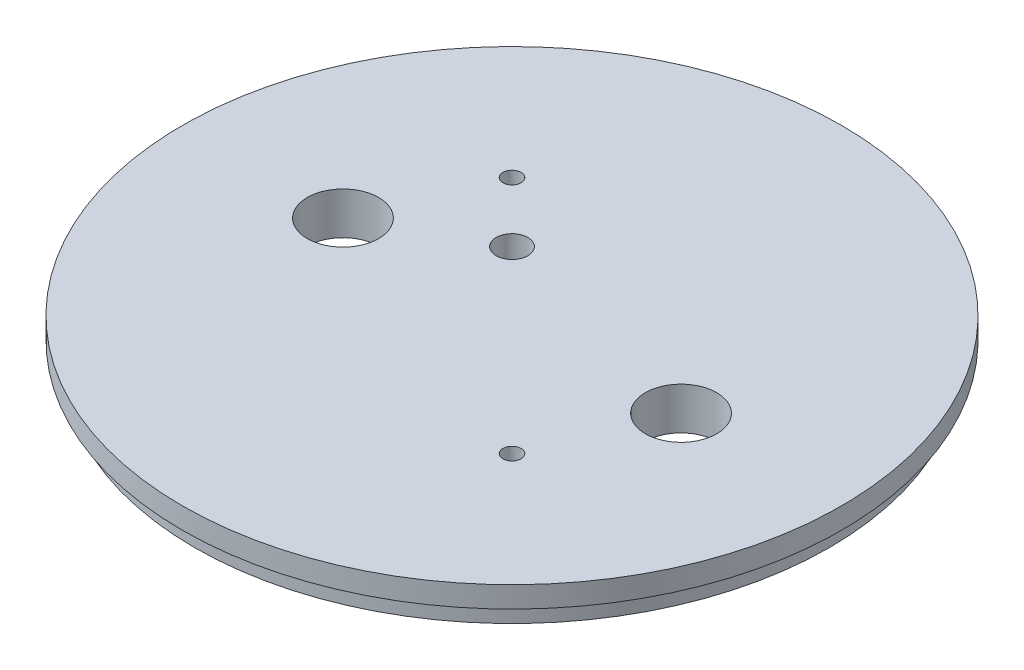
from build123d import *

# Parameters (mm, degrees)
SKETCH1_R           = 49.5173
SKETCH1_R_2         = 5.3578125
SKETCH1_R_3         = 1.3589
SKETCH1_R_4         = 2.38125
BOSS_EXTRUDE1_DEPTH = 6.35
SKETCH2_R           = 49.5173
SKETCH2_R_2         = 47.6885
CUT_EXTRUDE1_DEPTH  = 3.175
CUT_EXTRUDE2_START  = -2.794
CUT_EXTRUDE2_DEPTH  = 3.81


with BuildPart() as part:
    # Sketch1 → Boss-Extrude1 (new body)
    with BuildSketch(Plane(origin=(0, 0, 0), x_dir=(1, 0, 0), z_dir=(0, 1, 0))):
        Circle(SKETCH1_R)
        with Locations((25.4, 0)):
            Circle(SKETCH1_R_2, mode=Mode.SUBTRACT)
        with Locations((-25.4, 0)):
            Circle(SKETCH1_R_2, mode=Mode.SUBTRACT)
        with Locations((-17.960512242, 17.960512242)):
            Circle(SKETCH1_R_3, mode=Mode.SUBTRACT)
        with Locations((17.960512242, -17.960512242)):
            Circle(SKETCH1_R_3, mode=Mode.SUBTRACT)
        with Locations((-8.980256121, 8.980256121)):
            Circle(SKETCH1_R_4, mode=Mode.SUBTRACT)
    extrude(amount=BOSS_EXTRUDE1_DEPTH)

    # Sketch2 → Cut-Extrude1 (cut)
    with BuildSketch(Plane.XZ):
        Circle(SKETCH2_R)
        Circle(SKETCH2_R_2, mode=Mode.SUBTRACT)
    extrude(amount=-CUT_EXTRUDE1_DEPTH, mode=Mode.SUBTRACT)

    # Sketch3 → Cut-Extrude2 (cut)
    with BuildSketch(Plane(origin=(0, 6.35, 0), x_dir=(1, 0, 0), z_dir=(0, 1, 0)).offset(CUT_EXTRUDE2_START)):
        with BuildLine():
            Line((3.2385, 34.798), (3.2385, 13.97))
            ThreePointArc((3.2385, 13.97), (0, 10.7315), (-3.2385, 13.97))
            Line((-3.2385, 13.97), (-3.2385, 34.798))
            ThreePointArc((-3.2385, 34.798), (0, 38.0365), (3.2385, 34.798))
        make_face()
        with BuildLine():
            Line((3.2385, -34.798), (3.2385, -13.97))
            ThreePointArc((3.2385, -13.97), (0, -10.7315), (-3.2385, -13.97))
            Line((-3.2385, -13.97), (-3.2385, -34.798))
            ThreePointArc((-3.2385, -34.798), (0, -38.0365), (3.2385, -34.798))
        make_face()
    extrude(amount=-CUT_EXTRUDE2_DEPTH, mode=Mode.SUBTRACT)


solid = part.part
